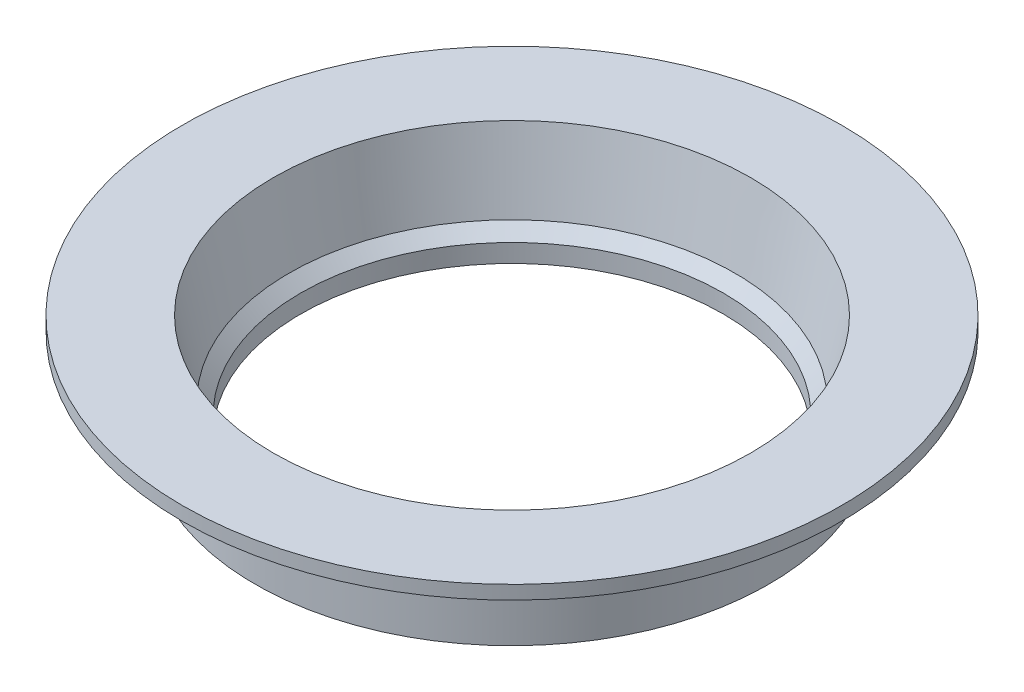
from build123d import *

# Parameters (mm, degrees)
CHAMFER1_SIZE2 = 1
CHAMFER1_SIZE  = 1.294432523


with BuildPart() as part:
    # Sketch2 → Revolve1 (revolve)
    with BuildSketch(Plane.XY, mode=Mode.PRIVATE) as revolve1_sk:
        Polygon((28.25, 0), (28.25, 10), (36.25, 10), (36.25, 11.5), (26.25, 11.5), (24.25, 2), (23.25, 2), (23.25, 0), align=None)
    revolve(revolve1_sk.sketch.rotate(Axis((0, 0, 0), (0, 1, 0)), 90), axis=Axis((0, 0, 0), (0, 1, 0)))

    # Chamfer1
    chamfer1_edges = [part.edges().sort_by_distance(p)[0] for p in [
        (0, 2, 24.25),
    ]]
    chamfer1_side = [part.faces().sort_by_distance(p)[0] for p in [
        (0, 2.019570996, 24.25412021),
    ]]
    chamfer(chamfer1_edges, length=CHAMFER1_SIZE - 0.0001, length2=CHAMFER1_SIZE2 - 0.0001, reference=chamfer1_side[0])  # a hair under: the kernel refuses the full size


solid = part.part
